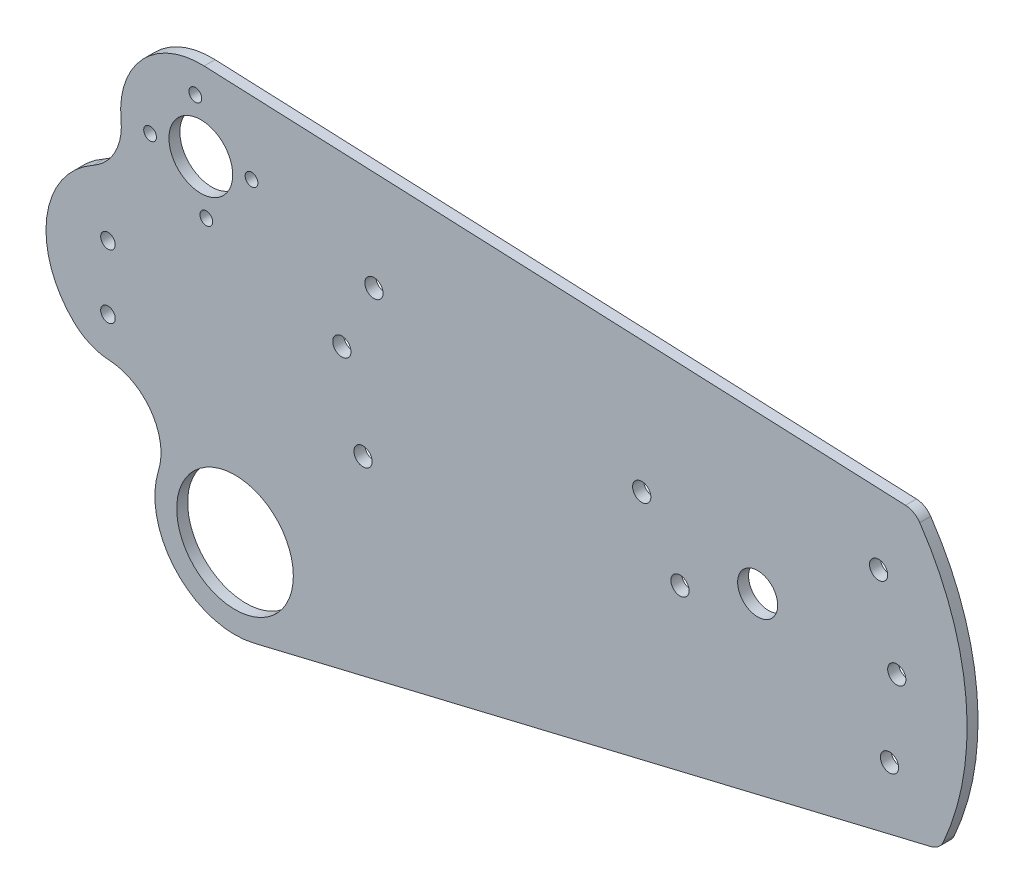
from build123d import *

# Parameters (mm, degrees)
SKETCH1_R           = 2.5
SKETCH1_R_2         = 5.5
SKETCH1_R_3         = 2
SKETCH1_R_4         = 16
SKETCH1_R_5         = 1.75
SKETCH1_R_6         = 8.75
BOSS_EXTRUDE1_DEPTH = 3


with BuildPart() as part:
    # Sketch1 → Boss-Extrude1 (new body)
    with BuildSketch(Plane.XY):
        with BuildLine():
            ThreePointArc((-111.886028634, 49.480245878), (-128.824449864, 42.592956949), (-134.705774542, 25.279526249))
            ThreePointArc((-134.705774542, 25.279526249), (-136.343375771, 16.802270376), (-142.382746132, 10.632050724))
            ThreePointArc((-142.382746132, 10.632050724), (-155.099864059, -8.058287742), (-147.542861296, -29.364285714))
            ThreePointArc((-147.542861296, -29.364285714), (-143.125485566, -32.280163581), (-137.970351553, -33.480224156))
            ThreePointArc((-137.970351553, -33.480224156), (-126.431132561, -39.888203569), (-124.422839539, -52.93360637))
            ThreePointArc((-124.422839539, -52.93360637), (-119.496486497, -74.516552798), (-98.295163417, -80.888085619))
            Line((-98.295163417, -80.888085619), (87.599861039, -36.324111832))
            ThreePointArc((87.599861039, -36.324111832), (89.628937626, -35.308169791), (91, -33.5))
            ThreePointArc((91, -33.5), (97.203558128, 3.661751943), (84.51565505, 39.137054004))
            ThreePointArc((84.51565505, 39.137054004), (82.813644384, 40.69192784), (80.594954641, 41.317938046))
            Line((80.594954641, 41.317938046), (-111.886028634, 49.480245878))
        make_face()
        with Locations((76.2, -22)):
            Circle(SKETCH1_R, mode=Mode.SUBTRACT)
        with Locations((18.7, -8.7)):
            Circle(SKETCH1_R, mode=Mode.SUBTRACT)
        with Locations((8.2, 8.3)):
            Circle(SKETCH1_R, mode=Mode.SUBTRACT)
        with Locations((40.017782272, 0)):
            Circle(SKETCH1_R_2, mode=Mode.SUBTRACT)
        with Locations((78.2, -0.1)):
            Circle(SKETCH1_R, mode=Mode.SUBTRACT)
        with Locations((73.2, 22.3)):
            Circle(SKETCH1_R, mode=Mode.SUBTRACT)
        with Locations((-138.3, -22.75)):
            Circle(SKETCH1_R_3, mode=Mode.SUBTRACT)
        with Locations((-68.3, -21.5)):
            Circle(SKETCH1_R, mode=Mode.SUBTRACT)
        with Locations((-138.3, -5.25)):
            Circle(SKETCH1_R_3, mode=Mode.SUBTRACT)
        with Locations((-74.1, 1.7)):
            Circle(SKETCH1_R, mode=Mode.SUBTRACT)
        with Locations((-65.3, 20)):
            Circle(SKETCH1_R, mode=Mode.SUBTRACT)
        with Locations((-103.42383694, -59.494238188)):
            Circle(SKETCH1_R_4, mode=Mode.SUBTRACT)
        with Locations((-98.899040178, 29.003085016)):
            Circle(SKETCH1_R_5, mode=Mode.SUBTRACT)
        with Locations((-114.321203303, 41.41907811)):
            Circle(SKETCH1_R_5, mode=Mode.SUBTRACT)
        with Locations((-111.315033272, 13.58092189)):
            Circle(SKETCH1_R_5, mode=Mode.SUBTRACT)
        with Locations((-126.737196398, 25.996914984)):
            Circle(SKETCH1_R_5, mode=Mode.SUBTRACT)
        with Locations((-112.818118288, 27.5)):
            Circle(SKETCH1_R_6, mode=Mode.SUBTRACT)
    extrude(amount=BOSS_EXTRUDE1_DEPTH)


solid = part.part
